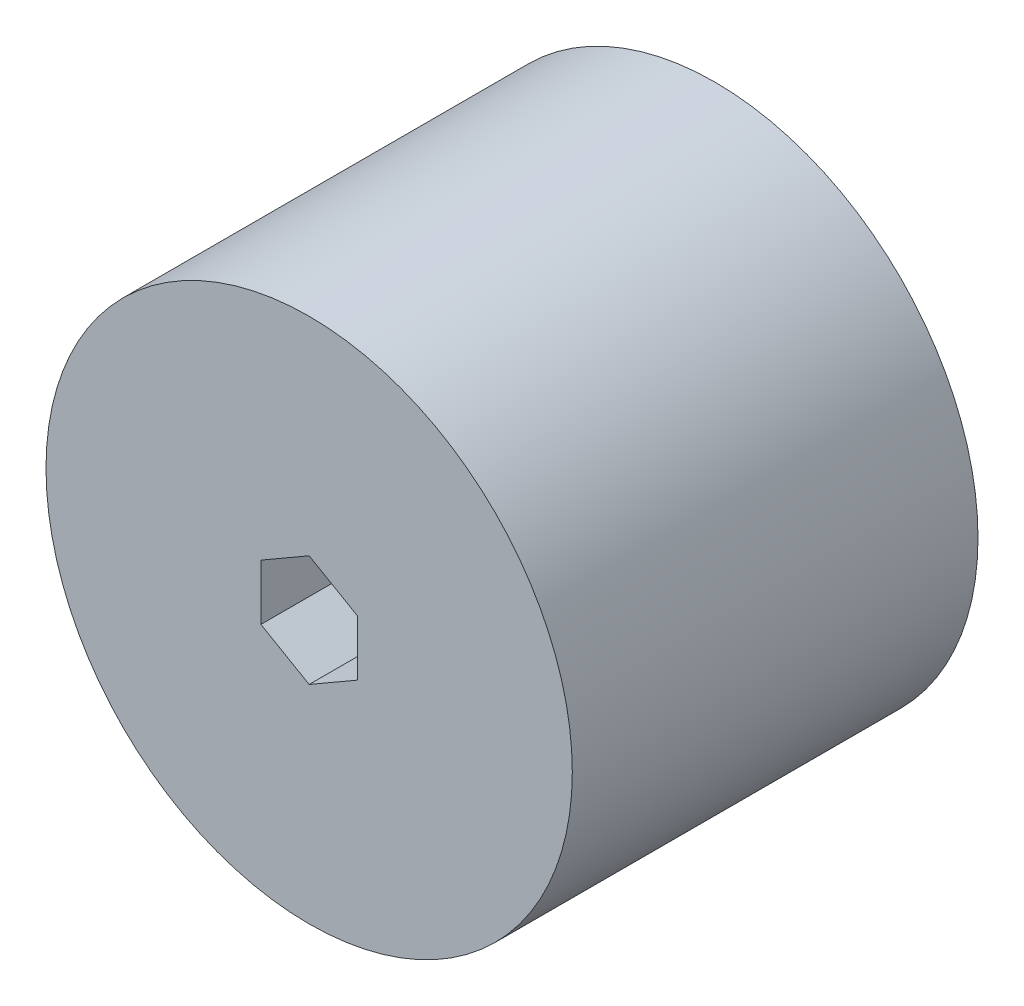
from build123d import *

# Parameters (mm, degrees)
SKETCH1_R           = 38.1
BOSS_EXTRUDE1_DEPTH = 58.7375


with BuildPart() as part:
    # Sketch1 → Boss-Extrude1 (new body)
    with BuildSketch(Plane.XY):
        Circle(SKETCH1_R)
        Polygon((0, 8.065583261), (-6.985, 4.03279163), (-6.985, -4.03279163), (0, -8.065583261), (6.985, -4.03279163), (6.985, 4.03279163), align=None, mode=Mode.SUBTRACT)
    extrude(amount=BOSS_EXTRUDE1_DEPTH)


solid = part.part
